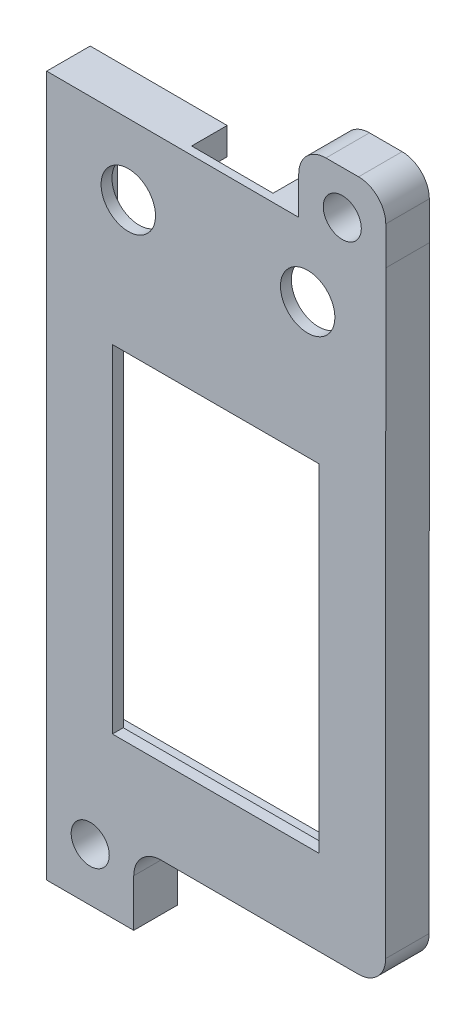
from build123d import *

# Parameters (mm, degrees)
SKETCH1_R           = 1.75
BOSS_EXTRUDE1_DEPTH = 1
SKETCH2_R           = 1.75
BOSS_EXTRUDE2_DEPTH = 2
SKETCH3_R           = 2.5
SKETCH3_R_2         = 1.75
SKETCH3_W           = 19
SKETCH3_H           = 31
BOSS_EXTRUDE3_DEPTH = 1
SKETCH5_W           = 3.6
SKETCH5_H           = 4.6
CUT_EXTRUDE1_DEPTH  = 21
SKETCH6_W           = 7.481125984
SKETCH6_H           = 3.264834395
CUT_EXTRUDE2_DEPTH  = 21


with BuildPart() as part:
    # Sketch1 → Boss-Extrude1 (new body)
    with BuildSketch(Plane.XY):
        with BuildLine():
            Line((-16.190243996, 8), (-8.190243996, 8))
            Line((-8.190243996, 8), (-8.190243996, 12.347767597))
            ThreePointArc((-8.190243996, 12.347767597), (-7.457132066, 14.116412996), (-5.687758756, 14.847766361))
            Line((-5.687758756, 14.847766361), (12.457152731, 14.82972857))
            ThreePointArc((12.457152731, 14.82972857), (14.226319825, 15.560875949), (14.959637903, 17.329144394))
            Line((14.959637903, 17.329144394), (14.972457582, 72.307640303))
            Line((14.972457582, 72.307640303), (14.972457582, 75.807640303))
            ThreePointArc((14.972457582, 75.807640303), (14.240224535, 77.575407256), (12.472457582, 78.307640303))
            Line((12.472457582, 78.307640303), (9.472457582, 78.307640303))
            ThreePointArc((9.472457582, 78.307640303), (7.704690629, 77.575407256), (6.972457582, 75.807640303))
            Line((6.972457582, 75.807640303), (6.972457582, 72.327883256))
            Line((6.972457582, 72.327883256), (-16.190243996, 72.386493441))
            Line((-16.190243996, 72.386493441), (-16.190243996, 8))
        make_face()
        with Locations((10.972926187, 74.317766997)):
            Circle(SKETCH1_R, mode=Mode.SUBTRACT)
        with Locations((-12.190243996, 12.854229471)):
            Circle(SKETCH1_R, mode=Mode.SUBTRACT)
        Polygon((-13.690243996, 17.355722839), (12.459637971, 17.329727334), (12.471876047, 69.813959694), (-13.690243996, 69.880159515), align=None, mode=Mode.SUBTRACT)
    extrude(amount=BOSS_EXTRUDE1_DEPTH)

    # Sketch2 → Boss-Extrude2 (add)
    with BuildSketch(Plane.XY.offset(1)):
        with BuildLine():
            Line((-5.687758756, 14.847766361), (12.457152731, 14.82972857))
            ThreePointArc((12.457152731, 14.82972857), (14.226319825, 15.560875949), (14.959637903, 17.329144394))
            Line((14.959637903, 17.329144394), (14.972457582, 72.307640303))
            Line((14.972457582, 72.307640303), (14.972457582, 75.807640303))
            ThreePointArc((14.972457582, 75.807640303), (14.240224535, 77.575407256), (12.472457582, 78.307640303))
            Line((12.472457582, 78.307640303), (9.472457582, 78.307640303))
            ThreePointArc((9.472457582, 78.307640303), (7.704690629, 77.575407256), (6.972457582, 75.807640303))
            Line((6.972457582, 75.807640303), (6.972457582, 72.327883256))
            Line((6.972457582, 72.327883256), (-16.190243996, 72.386493441))
            Line((-16.190243996, 72.386493441), (-16.190243996, 8))
            Line((-16.190243996, 8), (-8.190243996, 8))
            Line((-8.190243996, 8), (-8.190243996, 12.347767597))
            ThreePointArc((-8.190243996, 12.347767597), (-7.457132066, 14.116412996), (-5.687758756, 14.847766361))
        make_face()
        with Locations((10.972926187, 74.317766997)):
            Circle(SKETCH2_R, mode=Mode.SUBTRACT)
        with Locations((-12.190243996, 12.854229471)):
            Circle(SKETCH2_R, mode=Mode.SUBTRACT)
        Polygon((-13.690243996, 21.330577559), (12.460570874, 21.330577559), (12.471876047, 69.813959694), (-13.690243996, 69.880159515), align=None, mode=Mode.SUBTRACT)
    extrude(amount=BOSS_EXTRUDE2_DEPTH)

    # Sketch3 → Boss-Extrude3 (add)
    with BuildSketch(Plane.XY.offset(3)):
        with BuildLine():
            Line((-5.687758756, 14.847766361), (12.457152731, 14.82972857))
            ThreePointArc((12.457152731, 14.82972857), (14.226319825, 15.560875949), (14.959637903, 17.329144394))
            Line((14.959637903, 17.329144394), (14.972457582, 72.307640303))
            Line((14.972457582, 72.307640303), (14.972457582, 75.807640303))
            ThreePointArc((14.972457582, 75.807640303), (14.240224535, 77.575407256), (12.472457582, 78.307640303))
            Line((12.472457582, 78.307640303), (9.472457582, 78.307640303))
            ThreePointArc((9.472457582, 78.307640303), (7.704690629, 77.575407256), (6.972457582, 75.807640303))
            Line((6.972457582, 75.807640303), (6.972457582, 72.327883256))
            Line((6.972457582, 72.327883256), (-16.190243996, 72.386493441))
            Line((-16.190243996, 72.386493441), (-16.190243996, 8))
            Line((-16.190243996, 8), (-8.190243996, 8))
            Line((-8.190243996, 8), (-8.190243996, 12.347767597))
            ThreePointArc((-8.190243996, 12.347767597), (-7.457132066, 14.116412996), (-5.687758756, 14.847766361))
        make_face()
        with Locations((-8.691139187, 65.873523259)):
            Circle(SKETCH3_R, mode=Mode.SUBTRACT)
        with Locations((7.793457065, 66.02592423)):
            Circle(SKETCH3_R, mode=Mode.SUBTRACT)
        with Locations((10.972926187, 74.317766997)):
            Circle(SKETCH3_R_2, mode=Mode.SUBTRACT)
        with Locations((-12.190243996, 12.854229471)):
            Circle(SKETCH3_R_2, mode=Mode.SUBTRACT)
        with Locations((-0.652076914, 38.14822724)):
            Rectangle(SKETCH3_W, SKETCH3_H, mode=Mode.SUBTRACT)
    extrude(amount=BOSS_EXTRUDE3_DEPTH)

    # Sketch5 → Cut-Extrude1 (cut)
    with BuildSketch(Plane.ZY.offset(16.190243996)):
        with Locations((0.78983946, 57.439422967)):
            Rectangle(SKETCH5_W, SKETCH5_H)
    extrude(amount=-CUT_EXTRUDE1_DEPTH, mode=Mode.SUBTRACT)

    # Sketch6 → Cut-Extrude2 (cut)
    with BuildSketch(Plane(origin=(0.183059712, 72.345062939, 0), x_dir=(0.9999967986314592, -0.0025303610084290717, 0), z_dir=(0.0025303610084290713, 0.9999967986314591, 0))):
        with Locations((-0.046256432, -1.632417198)):
            Rectangle(SKETCH6_W, SKETCH6_H)
    extrude(amount=-CUT_EXTRUDE2_DEPTH, mode=Mode.SUBTRACT)


solid = part.part
